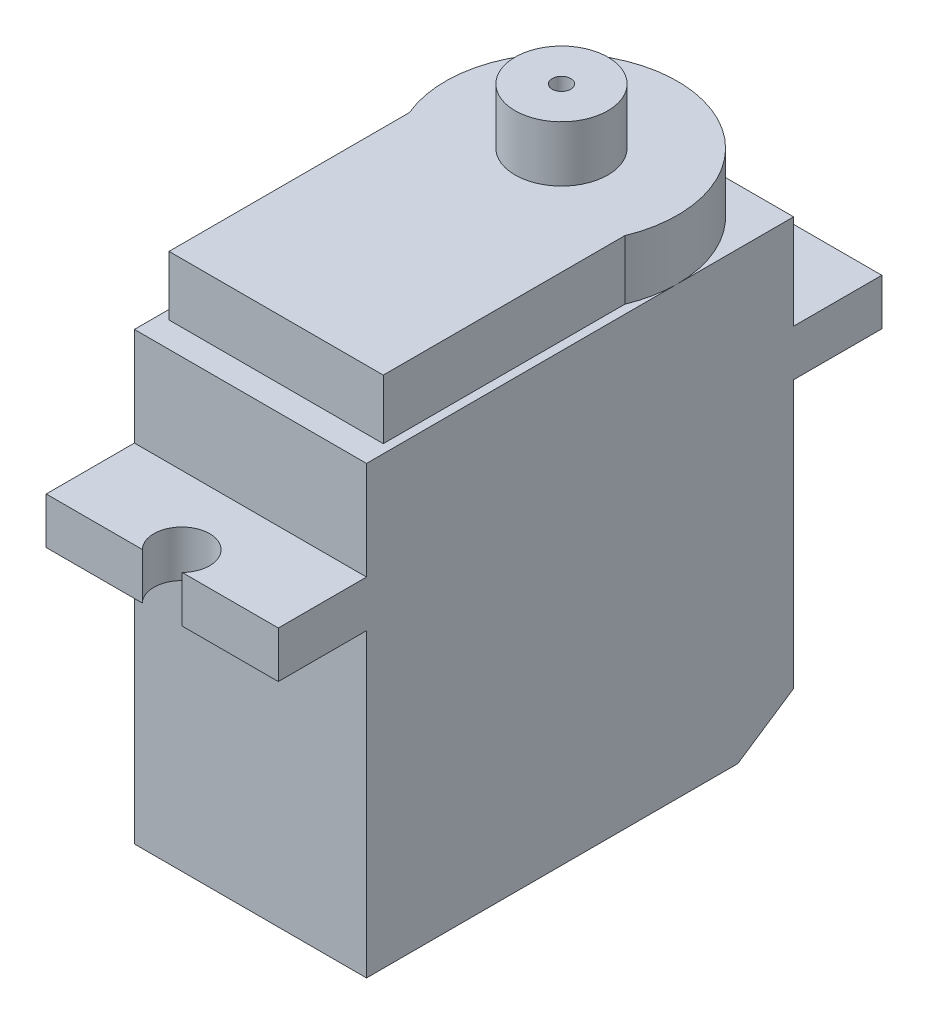
from build123d import *

# Parameters (mm, degrees)
SKETCH1_W           = 12.5
SKETCH1_H           = 23
BOSS_EXTRUDE1_DEPTH = 24
BOSS_EXTRUDE2_DEPTH = 3.2
SKETCH3_R           = 2.5
SKETCH3_R_2         = 0.5
BOSS_EXTRUDE3_DEPTH = 3
SKETCH4_W           = 12.5
SKETCH4_H           = 2.5
BOSS_EXTRUDE4_DEPTH = 4.75
SKETCH5_W           = 12.5
SKETCH5_H           = 2.5
BOSS_EXTRUDE5_DEPTH = 4.75
CUT_EXTRUDE1_REACH  = 27.55
SKETCH6_R           = 1.5
CUT_EXTRUDE2_REACH  = 27.697
SKETCH8_R           = 1.5
CUT_EXTRUDE4_DEPTH  = 37.501404083


with BuildPart() as part:
    # Sketch1 → Boss-Extrude1 (new body)
    with BuildSketch(Plane(origin=(0, 0, 0), x_dir=(1, 0, 0), z_dir=(0, 1, 0))):
        Rectangle(SKETCH1_W, SKETCH1_H)
    extrude(amount=BOSS_EXTRUDE1_DEPTH)

    # Sketch2 → Boss-Extrude2 (add)
    with BuildSketch(Plane(origin=(0, 24, 0), x_dir=(1, 0, 0), z_dir=(0, 1, 0))):
        with BuildLine():
            Line((-5.757621024, 2.818477812), (-5.757621024, -10.12881992))
            Line((-5.757621024, -10.12881992), (5.781688552, -10.12881992))
            Line((5.781688552, -10.12881992), (5.781688552, 2.876273501))
            ThreePointArc((5.781688552, 2.876273501), (-0.031303305, 11.499921608), (-5.757621024, 2.818477812))
        make_face()
    extrude(amount=BOSS_EXTRUDE2_DEPTH)

    # Sketch3 → Boss-Extrude3 (add)
    with BuildSketch(Plane(origin=(0, 27.2, 0), x_dir=(1, 0, 0), z_dir=(0, 1, 0))):
        with Locations((0, 5.25)):
            Circle(SKETCH3_R)
        with Locations((0, 5.25)):
            Circle(SKETCH3_R_2, mode=Mode.SUBTRACT)
    extrude(amount=BOSS_EXTRUDE3_DEPTH)

    # Sketch4 → Boss-Extrude4 (add)
    with BuildSketch(Plane(origin=(0, 0, -11.5), x_dir=(-1, 0, 0), z_dir=(0, 0, -1))):
        with Locations((0, 17.65)):
            Rectangle(SKETCH4_W, SKETCH4_H)
    extrude(amount=BOSS_EXTRUDE4_DEPTH)

    # Sketch5 → Boss-Extrude5 (add)
    with BuildSketch(Plane.XY.offset(11.5)):
        with Locations((0, 17.45)):
            Rectangle(SKETCH5_W, SKETCH5_H)
    extrude(amount=BOSS_EXTRUDE5_DEPTH)

    # Sketch6 → Cut-Extrude1 (cut, up to next)
    with BuildSketch(Plane(origin=(0, 18.7, 0), x_dir=(1, 0, 0), z_dir=(0, 1, 0)), mode=Mode.PRIVATE) as cut_extrude1_sk1:
        with Locations((0, -15.2)):
            Circle(SKETCH6_R)
    cut_extrude1_tool1 = extrude(cut_extrude1_sk1.sketch, amount=-CUT_EXTRUDE1_REACH, mode=Mode.PRIVATE) & part.part
    add(cut_extrude1_tool1.solids().sort_by_distance((0, 18.7, 15.2))[0], mode=Mode.SUBTRACT)

    # Sketch8 → Cut-Extrude2 (cut, up to next)
    with BuildSketch(Plane(origin=(0, 18.9, 0), x_dir=(1, 0, 0), z_dir=(0, 1, 0)), mode=Mode.PRIVATE) as cut_extrude2_sk1:
        with Locations((0, 15.2)):
            Circle(SKETCH8_R)
    cut_extrude2_tool1 = extrude(cut_extrude2_sk1.sketch, amount=-CUT_EXTRUDE2_REACH, mode=Mode.PRIVATE) & part.part
    add(cut_extrude2_tool1.solids().sort_by_distance((0, 18.9, -15.2))[0], mode=Mode.SUBTRACT)

    # Sketch9 → Cut-Extrude4 (cut, through all)
    with BuildSketch(Plane(origin=(6.25, 0, 0), x_dir=(0, 0, -1), z_dir=(1, 0, 0))):
        Polygon((11.5, 2), (8.5, 0), (11.5, 0), align=None)
    extrude(amount=-CUT_EXTRUDE4_DEPTH, mode=Mode.SUBTRACT)


solid = part.part
